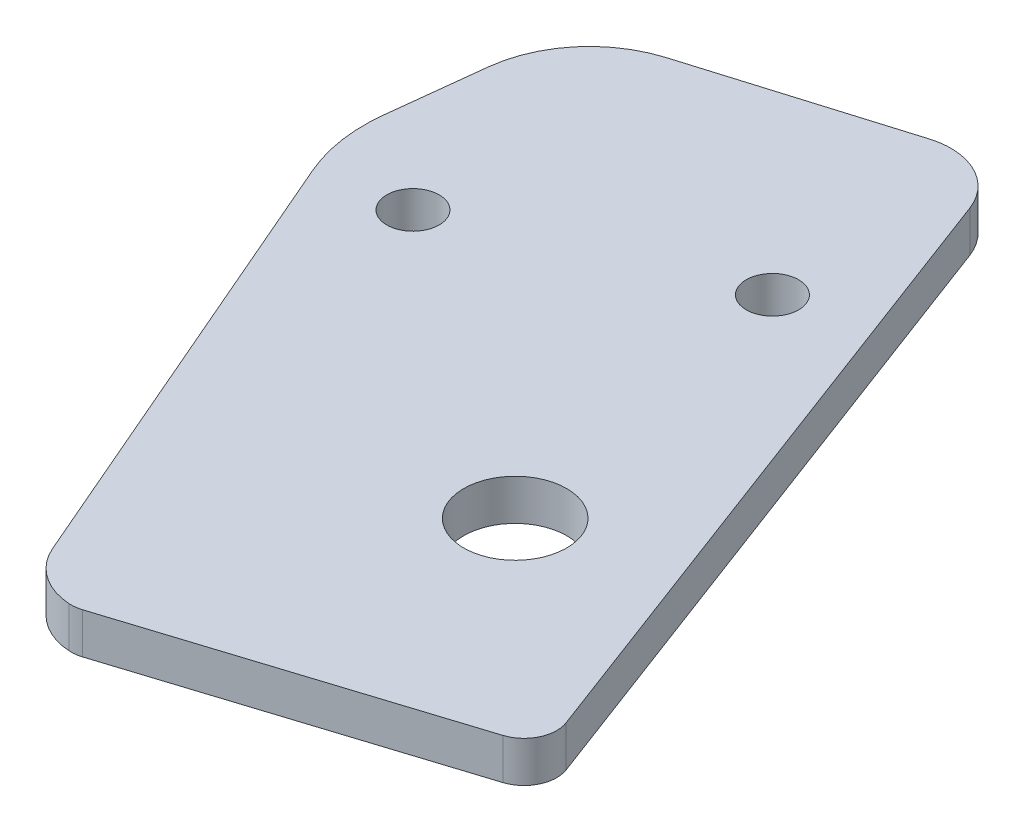
from build123d import *

# Parameters (mm, degrees)
BOSS_EXTRUDE1_DEPTH = 3.175
SKETCH2_R           = 2.032
BOSS_EXTRUDE2_DEPTH = 3.175
SKETCH2_3_R         = 4
CUT_EXTRUDE1_DEPTH  = 63.201892938
FILLET1_R           = 2.54


with BuildPart() as part:
    # Sketch1 → Boss-Extrude1 (new body)
    with BuildSketch(Plane(origin=(0, 0, 0), x_dir=(1, 0, 0), z_dir=(0, 1, 0))):
        Polygon((25.4, -6.35), (12.7, -6.35), (12.7, 19.05), (-12.7, 19.05), (-12.7, -19.05), (25.4, -19.05), align=None)
    extrude(amount=BOSS_EXTRUDE1_DEPTH)

    # Sketch2 → Boss-Extrude2 (add)
    # profile 1 of 2: a face of its own
    with BuildSketch(Plane.XZ):
        Polygon((12.7, 1.472649747), (13.949167892, 4.789594929), (12.7, 5.186439946), align=None)
    # profile 2 of 2: a face of its own
    with BuildSketch(Plane.XZ):
        with BuildLine():
            Line((-12.7, 13.255702289), (-13.373056837, 13.469524029))
            ThreePointArc((-13.373056837, 13.469524029), (-13.831582673, 13.569694165), (-14.300710901, 13.583790422))
            ThreePointArc((-14.300710901, 13.583790422), (-16.90590193, 12.668940106), (-18.647730427, 10.526510437))
            Line((-18.647730427, 10.526510437), (-33.997782473, -25.04377908))
            ThreePointArc((-33.997782473, -25.04377908), (-34.900150323, -28.214966504), (-34.955795775, -31.511570969))
            Line((-34.955795775, -31.511570969), (-34.123437377, -38.826910048))
            ThreePointArc((-34.123437377, -38.826910048), (-32.117046877, -43.516551498), (-27.863250656, -46.331432931))
            Line((-27.863250656, -46.331432931), (-12.15852304, -51.079668538))
            ThreePointArc((-12.15852304, -51.079668538), (-8.439878849, -50.772366449), (-5.934296975, -48.007441738))
            Line((-5.934296975, -48.007441738), (-0.611549336, -33.873823471))
            Line((-0.611549336, -33.873823471), (4.971130901, -19.05))
            Line((4.971130901, -19.05), (-12.7, -19.05))
            Line((-12.7, -19.05), (-12.7, 8.957831881))
            Line((-12.7, 8.957831881), (-12.7, 13.255702289))
        make_face()
        with Locations((-27.434824274, -26.25669415)):
            Circle(SKETCH2_R, mode=Mode.SUBTRACT)
        with Locations((-7.764936406, -34.507055205)):
            Circle(SKETCH2_R, mode=Mode.SUBTRACT)
    extrude(amount=-BOSS_EXTRUDE2_DEPTH)

    # Sketch2<3> → Cut-Extrude1 (cut, through all)
    with BuildSketch(Plane.XZ):
        Polygon((-12.7, 13.255702289), (12.7, 5.186439946), (12.7, 6.35), (25.4, 6.35), (25.4, 19.05), (-12.7, 19.05), align=None)
        Polygon((12.7, -19.05), (12.7, 1.472649747), (4.971130901, -19.05), align=None)
        with Locations((-2.723911437, -9.485123164)):
            Circle(SKETCH2_3_R)
    extrude(amount=-CUT_EXTRUDE1_DEPTH, mode=Mode.SUBTRACT)

    # Fillet1
    fillet1_edges = [part.edges().sort_by_distance(p)[0] for p in [
        (13.949167892, 1.5875, 4.789594929),
    ]]
    fillet(fillet1_edges, radius=FILLET1_R)


solid = part.part
